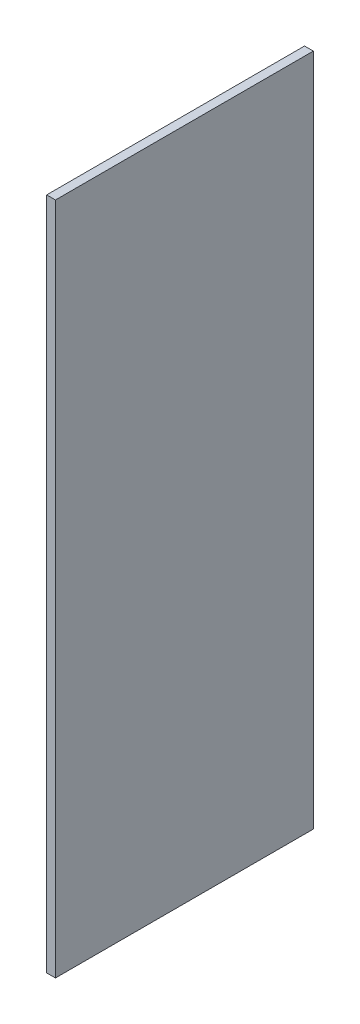
from build123d import *

# Parameters (mm, degrees)
SKETCH1_W           = 19.05
SKETCH1_H           = 1460.04871947
BOSS_EXTRUDE1_DEPTH = 558.8


with BuildPart() as part:
    # Sketch1 → Boss-Extrude1 (new body)
    with BuildSketch(Plane.XY):
        with Locations((-99.00949825, 726.121146921)):
            Rectangle(SKETCH1_W, SKETCH1_H)
    extrude(amount=BOSS_EXTRUDE1_DEPTH)


solid = part.part
